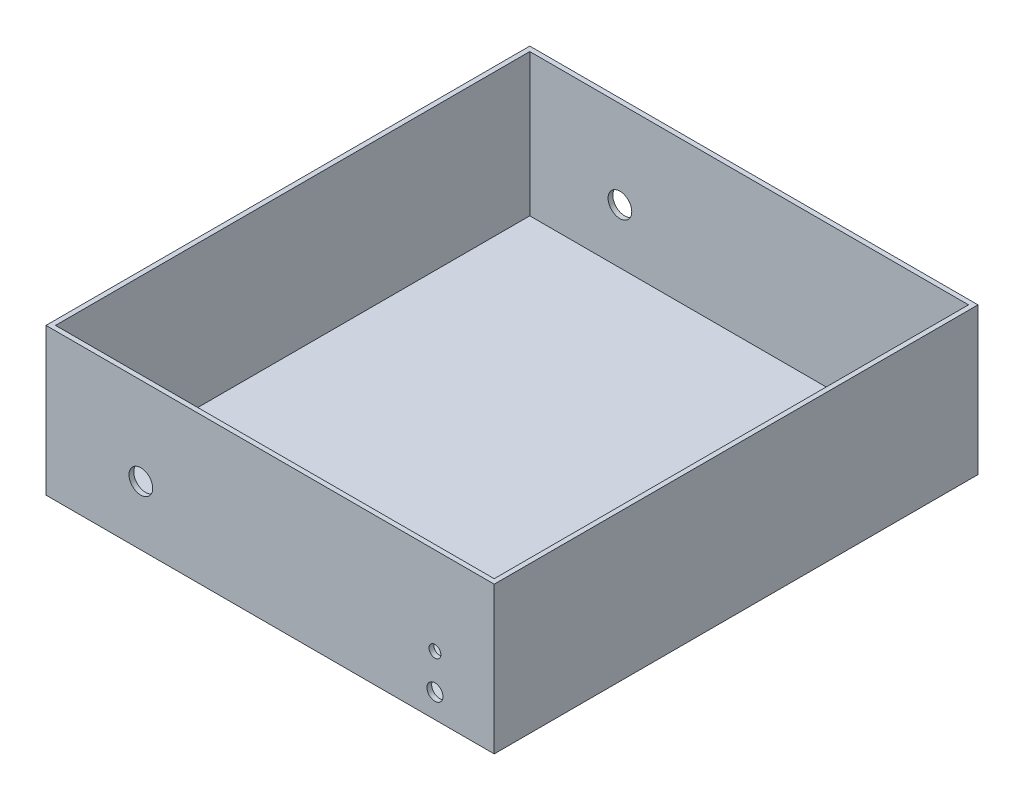
from build123d import *

# Parameters (mm, degrees)
SKETCH2_W          = 189
SKETCH2_H          = 204
SKETCH2_W_2        = 185
SKETCH2_H_2        = 200
WALLS_DEPTH        = 60
SKETCH3_W          = 189
SKETCH3_H          = 204
BASE_DEPTH         = 2
SKETCH4_R          = 2.5
SKETCH4_R_2        = 5
CUT_EXTRUDE1_DEPTH = 233.693467893
SKETCH5_R          = 3.3782
CUT_EXTRUDE2_DEPTH = 233.693467893


with BuildPart() as part:
    # Sketch2 → Walls (new body)
    with BuildSketch(Plane(origin=(0, 0, 0), x_dir=(1, 0, 0), z_dir=(0, 1, 0))):
        Rectangle(SKETCH2_W, SKETCH2_H)
        Rectangle(SKETCH2_W_2, SKETCH2_H_2, mode=Mode.SUBTRACT)
    extrude(amount=WALLS_DEPTH)

    # Sketch3 → Base (add)
    with BuildSketch(Plane.XZ):
        Rectangle(SKETCH3_W, SKETCH3_H)
    extrude(amount=BASE_DEPTH)

    # Sketch4 → Cut-Extrude1 (cut, through all)
    with BuildSketch(Plane(origin=(0, 0, -102), x_dir=(-1, 0, 0), z_dir=(0, 0, -1))):
        with Locations((-69.5, 23)):
            Circle(SKETCH4_R)
        with Locations((54.5, 23)):
            Circle(SKETCH4_R_2)
    extrude(amount=-CUT_EXTRUDE1_DEPTH, mode=Mode.SUBTRACT)

    # Sketch5 → Cut-Extrude2 (cut, through all)
    with BuildSketch(Plane(origin=(0, 0, -102), x_dir=(-1, 0, 0), z_dir=(0, 0, -1))):
        with Locations((-69.5, 8.09625)):
            Circle(SKETCH5_R)
    extrude(amount=-CUT_EXTRUDE2_DEPTH, mode=Mode.SUBTRACT)


solid = part.part
